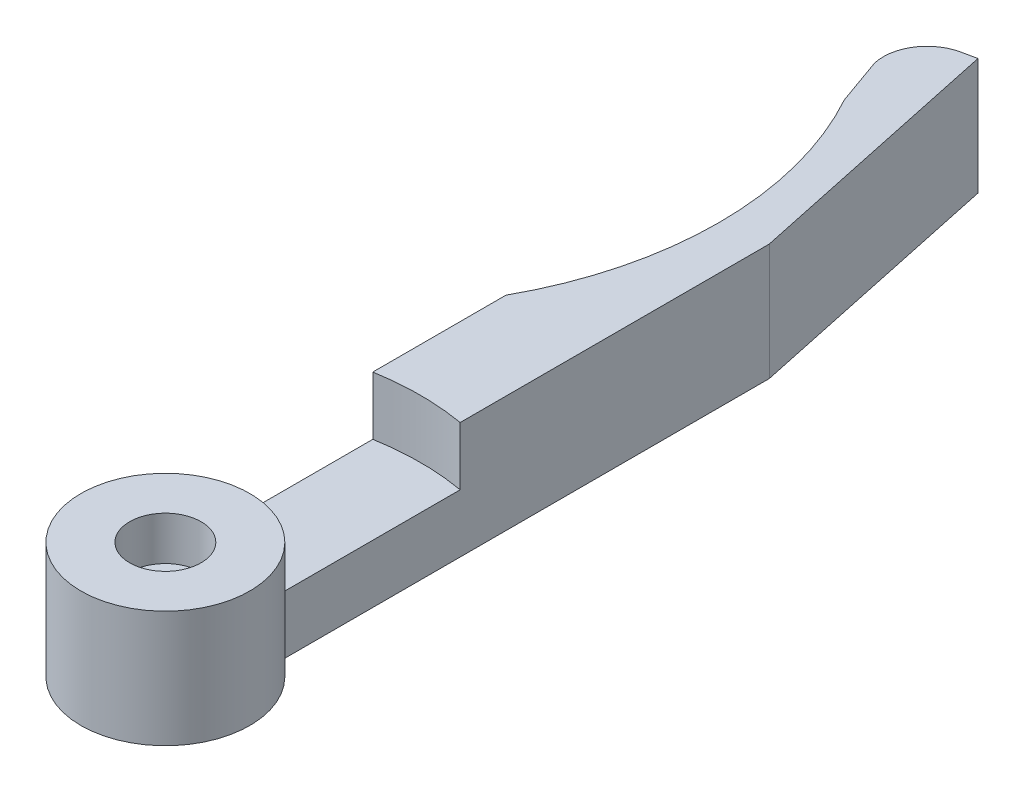
from build123d import *

# Parameters (mm, degrees)
BOSS_EXTRU_1_DEPTH      = 8
ESQUISSE2_R             = 2.45
ENL_V_MAT_EXTRU_1_DEPTH = 3
ENL_V_MAT_EXTRU_2_REACH = 59.173
ESQUISSE3_R             = 1.25
ESQUISSE4_R             = 3
ENL_V_MAT_EXTRU_3_DEPTH = 2
ENL_V_START             = -4
ENL_V_MAT_EXTRU_4_DEPTH = 4


with BuildPart() as part:
    # Esquisse1 → Boss.-Extru.1 (new body)
    with BuildSketch(Plane(origin=(0, 0, 0), x_dir=(1, 0, 0), z_dir=(0, 1, 0))):
        with BuildLine():
            Line((-3, 26.381049961), (-3, 4.963869458))
            ThreePointArc((-3, 4.963869458), (0, -5.8), (3, 4.963869458))
            Line((3, 4.963869458), (3, 38.463869458))
            Line((3, 38.463869458), (-0.867157449, 56.657414832))
            Line((-0.867157449, 56.657414832), (-1.84530505, 56.449503141))
            ThreePointArc((-1.84530505, 56.449503141), (-3.756758837, 55.119060789), (-4.140414176, 52.821988519))
            Line((-4.140414176, 52.821988519), (-3, 49.618950039))
            ThreePointArc((-3, 49.618950039), (0, 38), (-3, 26.381049961))
        make_face()
    extrude(amount=BOSS_EXTRU_1_DEPTH)

    # Esquisse2 → Enlèv. mat.-Extru.1 (cut)
    with BuildSketch(Plane(origin=(0, 8, 0), x_dir=(1, 0, 0), z_dir=(0, 1, 0))):
        Circle(ESQUISSE2_R)
    extrude(amount=-ENL_V_MAT_EXTRU_1_DEPTH, mode=Mode.SUBTRACT)

    # Esquisse3 → Enlèv. mat.-Extru.2 (cut, up to next)
    with BuildSketch(Plane(origin=(0, 5, 0), x_dir=(1, 0, 0), z_dir=(0, 1, 0)), mode=Mode.PRIVATE) as enl_v_mat_extru_2_sk1:
        Circle(ESQUISSE3_R)
    enl_v_mat_extru_2_tool1 = extrude(enl_v_mat_extru_2_sk1.sketch, amount=-ENL_V_MAT_EXTRU_2_REACH, mode=Mode.PRIVATE) & part.part
    add(enl_v_mat_extru_2_tool1.solids().sort_by_distance((0, 5, 0))[0], mode=Mode.SUBTRACT)

    # Esquisse4 → Enlèv. mat.-Extru.3 (cut)
    with BuildSketch(Plane.XZ):
        Circle(ESQUISSE4_R)
    extrude(amount=-ENL_V_MAT_EXTRU_3_DEPTH, mode=Mode.SUBTRACT)

    # Esquisse5 → Enlèv. mat.-Extru.4 (cut)
    with BuildSketch(Plane(origin=(0, 8, 0), x_dir=(1, 0, 0), z_dir=(0, 1, 0)).offset(ENL_V_START)):
        with BuildLine():
            Line((-3, 4.963869458), (-3, 17.24093965))
            ThreePointArc((-3, 17.24093965), (0, 17.5), (3, 17.24093965))
            Line((3, 17.24093965), (3, 4.963869458))
            ThreePointArc((3, 4.963869458), (0, 5.8), (-3, 4.963869458))
        make_face()
    extrude(amount=ENL_V_MAT_EXTRU_4_DEPTH, mode=Mode.SUBTRACT)


solid = part.part
